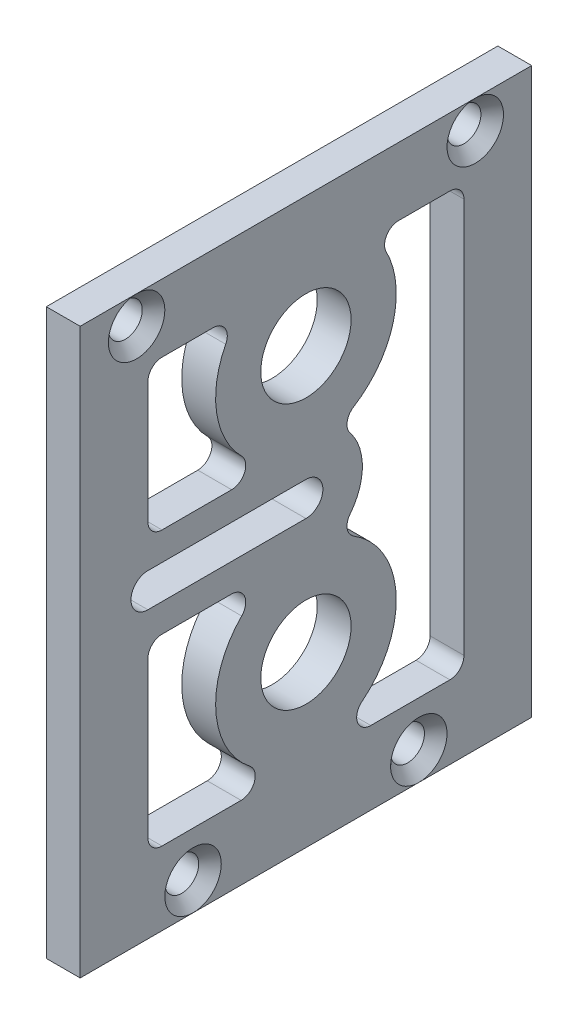
from build123d import *

# Parameters (mm, degrees)
ESQUISSE1_W      = 80
ESQUISSE1_H      = 100
EXTRUSION1_DEPTH = 6
ESQUISSE2_R      = 8
EXTRUSION3_DEPTH = 129.202964084
ESQUISSE3_R      = 3
EXTRUSION4_DEPTH = 129.202964084
EXTRUSION5_DEPTH = 129.202964084
CHANFREIN1_SIZE  = 2


with BuildPart() as part:
    # Esquisse1 → Extrusion1 (new body)
    with BuildSketch(Plane(origin=(0, 0, 0), x_dir=(0, 0, -1), z_dir=(1, 0, 0))):
        with Locations((40, 50)):
            Rectangle(ESQUISSE1_W, ESQUISSE1_H)
    extrude(amount=EXTRUSION1_DEPTH)

    # Esquisse2 → Extrusion3 (cut, through all)
    with BuildSketch(Plane(origin=(6, 0, 0), x_dir=(0, 0, -1), z_dir=(1, 0, 0))):
        with Locations((40, 77)):
            Circle(ESQUISSE2_R)
        with Locations((40, 30)):
            Circle(ESQUISSE2_R)
    extrude(amount=-EXTRUSION3_DEPTH, mode=Mode.SUBTRACT)

    # Esquisse3 → Extrusion4 (cut, through all)
    with BuildSketch(Plane(origin=(6, 0, 0), x_dir=(0, 0, -1), z_dir=(1, 0, 0))):
        with Locations((10, 95)):
            Circle(ESQUISSE3_R)
        with Locations(Location((70, 95, 0), (0, 0, 180))):
            Circle(ESQUISSE3_R)
        with Locations((20, 5)):
            Circle(ESQUISSE3_R)
        with Locations(Location((60, 5, 0), (0, 0, 180))):
            Circle(ESQUISSE3_R)
    extrude(amount=-EXTRUSION4_DEPTH, mode=Mode.SUBTRACT)

    # Esquisse4 → Extrusion5 (cut, through all)
    with BuildSketch(Plane(origin=(6, 0, 0), x_dir=(0, 0, -1), z_dir=(1, 0, 0))):
        with BuildLine():
            Line((14.5, 88), (23.568323275, 88))
            ThreePointArc((23.568323275, 88), (25.703928765, 86.799688112), (25.78882013, 84.351351351))
            ThreePointArc((25.78882013, 84.351351351), (24.18182416, 74.59473222), (28.616262416, 65.756756757))
            ThreePointArc((28.616262416, 65.756756757), (29.144270989, 63.036125499), (26.837553419, 61.5))
            Line((26.837553419, 61.5), (14.5, 61.5))
            ThreePointArc((14.5, 61.5), (12.732233047, 62.232233047), (12, 64))
            Line((12, 64), (12, 85.5))
            ThreePointArc((12, 85.5), (12.732233047, 87.267766953), (14.5, 88))
        make_face()
        with BuildLine():
            Line((12, 56.5), (40, 56.5))
            ThreePointArc((40, 56.5), (43, 53.5), (40, 50.5))
            Line((40, 50.5), (12, 50.5))
            ThreePointArc((12, 50.5), (9, 53.5), (12, 56.5))
        make_face()
        with BuildLine():
            Line((14.5, 45.5), (26.837553419, 45.5))
            ThreePointArc((26.837553419, 45.5), (29.144270989, 43.963874501), (28.616262416, 41.243243243))
            ThreePointArc((28.616262416, 41.243243243), (24.029537881, 29.028228573), (30.063459206, 17.459459459))
            ThreePointArc((30.063459206, 17.459459459), (30.871875411, 14.678005063), (28.510874707, 13))
            Line((28.510874707, 13), (14.5, 13))
            ThreePointArc((14.5, 13), (12.732233047, 13.732233047), (12, 15.5))
            Line((12, 15.5), (12, 43))
            ThreePointArc((12, 43), (12.732233047, 44.767766953), (14.5, 45.5))
        make_face()
        with BuildLine():
            Line((65.5, 13), (51.489125293, 13))
            ThreePointArc((51.489125293, 13), (49.128124589, 14.678005063), (49.936540794, 17.459459459))
            ThreePointArc((49.936540794, 17.459459459), (55.974264455, 30.907124639), (48.452969685, 43.584818861))
            ThreePointArc((48.452969685, 43.584818861), (47.310016798, 45.28313862), (47.818996959, 47.265957447))
            ThreePointArc((47.818996959, 47.265957447), (50, 53.5), (47.818996959, 59.734042553))
            ThreePointArc((47.818996959, 59.734042553), (47.310016798, 61.71686138), (48.452969685, 63.415181139))
            ThreePointArc((48.452969685, 63.415181139), (55.427142463, 72.756973317), (54.21117987, 84.351351351))
            ThreePointArc((54.21117987, 84.351351351), (54.296071235, 86.799688112), (56.431676725, 88))
            Line((56.431676725, 88), (65.5, 88))
            ThreePointArc((65.5, 88), (67.267766953, 87.267766953), (68, 85.5))
            Line((68, 85.5), (68, 15.5))
            ThreePointArc((68, 15.5), (67.267766953, 13.732233047), (65.5, 13))
        make_face()
    extrude(amount=-EXTRUSION5_DEPTH, mode=Mode.SUBTRACT)

    # Chanfrein1
    chanfrein1_edges = [part.edges().sort_by_distance(p)[0] for p in [
        (6, 95, -7),
        (6, 95, -73),
        (6, 5, -17),
        (6, 5, -63),
    ]]
    chamfer(chanfrein1_edges, length=CHANFREIN1_SIZE - 0.0001)  # a hair under: the kernel refuses the full size


solid = part.part
